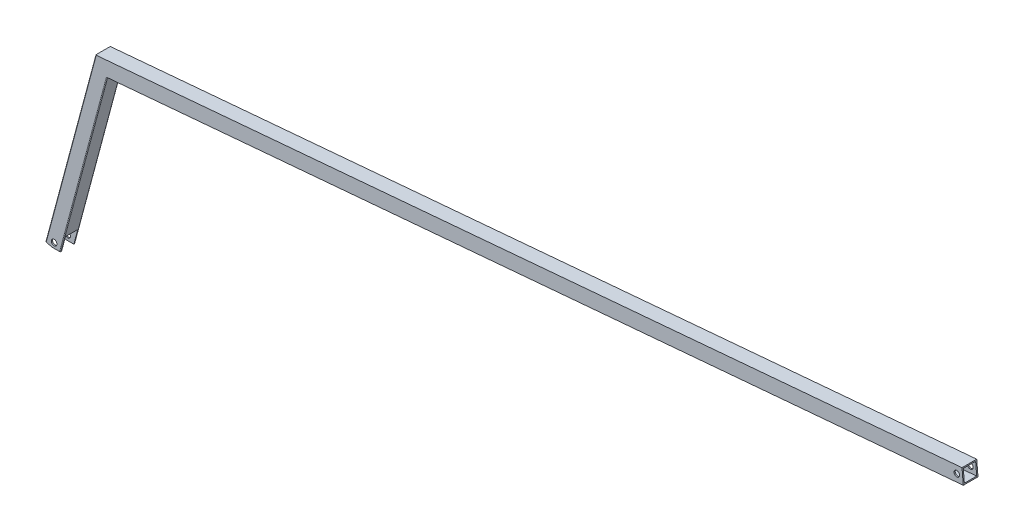
from build123d import *

# Parameters (mm, degrees)
SKETCH1_R           = 4.82599999999999
SKETCH1_R_2         = 4.825999999999997
BOSS_EXTRUDE1_DEPTH = 12.7
SHELL1_T            = -2.0574
FILLET1_R           = 1.27
CUT_EXTRUDE1_DEPTH  = 1714.433575902649
SKETCH3_W           = 21.285199999999943
SKETCH3_H           = 25.40000000000009
CUT_EXTRUDE2_DEPTH  = 1713.0984254933278
FILLET2_R           = 1.27


with BuildPart() as part:
    # Sketch1 → Boss-Extrude1 (new, symmetric)
    with BuildSketch(Plane(origin=(0, -98.29799999999999, -2.776e-14), x_dir=(-1, 0, 0), z_dir=(0, 0, -1))):
        Polygon((32.895539800283125, -12.243824987918671), (1529.236557174524, -143.1567007770127), (1615.5675093984726, -465.34820074258795), (1591.0329934107308, -471.92220448819177), (1509.305208165673, -166.9099575635606), (30.681783934492614, -37.54717031944891), align=None)
        with Locations((41.910000000000004, -25.781000000000002)):
            Circle(SKETCH1_R, mode=Mode.SUBTRACT)
        with Locations((1600.835, -459.4347591199864)):
            Circle(SKETCH1_R_2, mode=Mode.SUBTRACT)
    extrude(amount=BOSS_EXTRUDE1_DEPTH, both=True)

    # Shell1
    shell1_openings = [part.faces().sort_by_distance(p)[0] for p in [
        (-31.788661867, -123.193497654, 0),
        (-1603.300251405, -566.933202615, 0),
        (-1596.009, -557.73275912, 0),
        (-37.084, -124.079, 0),
    ]]
    offset(amount=SHELL1_T, openings=shell1_openings, kind=Kind.INTERSECTION)

    # Fillet1
    fillet1_edges = [part.edges().sort_by_distance(p)[0] for p in [
        (-1572.4020332864984, -402.55045075980036, -12.700000000000028),
        (-1551.9699683205642, -416.485826974324, 10.642599999999971),
        (-1570.6011657541362, -403.77870481135244, 10.642599999999971),
        (-1570.6011657541362, -403.77870481135244, -10.642600000000028),
        (-1551.9699683205642, -416.485826974324, -10.642600000000028),
        (-1572.4020332864984, -402.55045075980036, 12.69999999999997),
        (-1550.1691007882018, -417.71408102587617, 12.69999999999997),
        (-1550.1691007882018, -417.71408102587617, -12.700000000000028),
    ]]
    fillet(fillet1_edges, radius=FILLET1_R)

    # Sketch2 → Cut-Extrude1 (cut, through all)
    with BuildSketch(Plane(origin=(0, 0, -12.700000000000028), x_dir=(-1, 0, 0), z_dir=(0, 0, -1))):
        Polygon((1604.4588423023201, -566.6227591199881), (1590.0690608295056, -566.6227591199881), (1591.0329934107308, -570.2202044881918), align=None)
    extrude(amount=-CUT_EXTRUDE1_DEPTH, mode=Mode.SUBTRACT)

    # Sketch3 → Cut-Extrude2 (cut, through all)
    with BuildSketch(Plane(origin=(0, 0, 0), x_dir=(0, 0, -1), z_dir=(1, 0, 0))):
        with Locations((0, -553.9227591199873)):
            Rectangle(SKETCH3_W, SKETCH3_H)
    extrude(amount=-CUT_EXTRUDE2_DEPTH, mode=Mode.SUBTRACT)

    # Fillet2
    fillet2_edges = [part.edges().sort_by_distance(p)[0] for p in [
        (-1607.836777342822, -541.2227591199872, -10.642599999999971),
        (-1584.9855403231031, -541.2227591199872, -10.642599999999971),
        (-1607.836777342822, -541.2227591199872, 10.642599999999971),
        (-1584.9855403231031, -541.2227591199872, 10.642599999999971),
    ]]
    fillet(fillet2_edges, radius=FILLET2_R - 0.0001)  # a hair under: the kernel refuses the full size


solid = part.part
